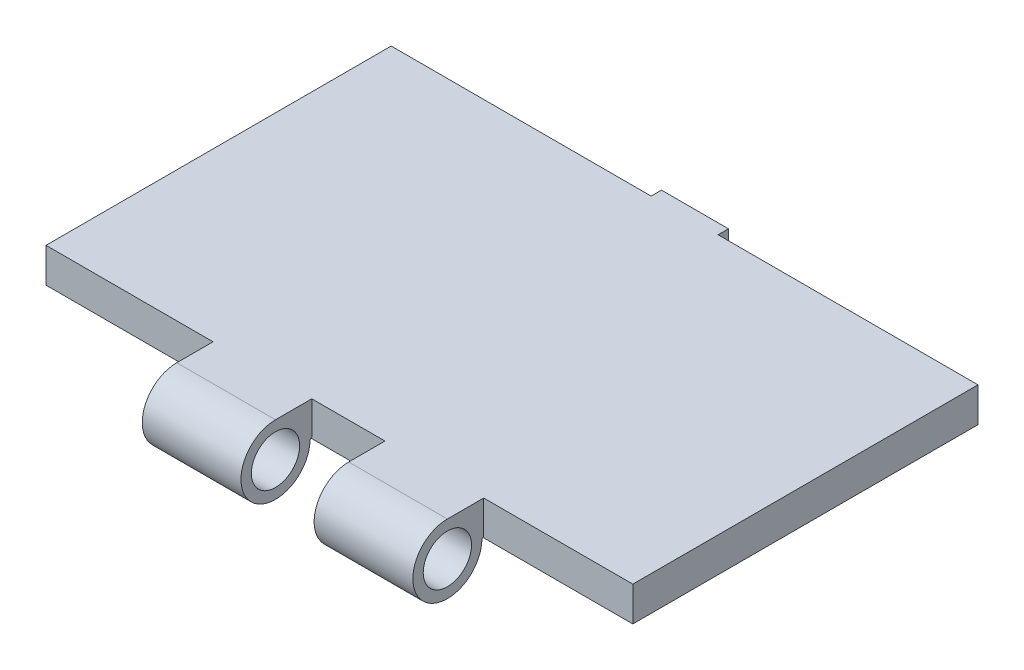
from build123d import *

# Parameters (mm, degrees)
ESQUISSE1_W                = 85
ESQUISSE1_H                = 50
BOSS_EXTRU_1_DEPTH         = 5
BOSS_EXTRU_2_START         = -14.3
BOSS_EXTRU_2_DEPTH         = 14.3
ESQUISSE3_R                = 3.5
ENL_V_MAT_EXTRU_1_DEPTH    = 14.3
R_P_TITION_LIN_AIRE2_COUNT = 2
R_P_TITION_LIN_AIRE2_PITCH = 24.9
BOSS_EXTRU_3_DEPTH         = 4.85
BOSS_EXTRU_3_DEPTH_BACK    = 4.85


# Read off the part's stored shape, not the designer's step: Boss.-Extru.2
with BuildPart() as part:
    # Esquisse1 → Boss.-Extru.1 (new body)
    with BuildSketch(Plane(origin=(0, 0, 0), x_dir=(1, 0, 0), z_dir=(0, 1, 0))):
        Rectangle(ESQUISSE1_W, ESQUISSE1_H)
    extrude(amount=BOSS_EXTRU_1_DEPTH)

    # Boss.-Extru.2 outline → Boss.-Extru.2 (add)
    with BuildSketch(Plane.ZY.offset(18.3).offset(BOSS_EXTRU_2_START)):
        with BuildLine():
            Line((25, 5), (25, 0.23226176))
            Line((25, 0.23226176), (25.260006787, -0.008238034))
            ThreePointArc((25.260006787, -0.008238034), (33.798445292, -3.53262012), (30.26, 5))
            Line((30.26, 5), (25, 5))
        make_face()
    boss_extru_2 = extrude(amount=BOSS_EXTRU_2_DEPTH)

    # Esquisse3 → Enlèv. mat.-Extru.1 (cut)
    with BuildSketch(Plane.ZY.offset(18.3)):
        with Locations((30.26, 0)):
            Circle(ESQUISSE3_R)
    enl_v_mat_extru_1 = extrude(amount=-ENL_V_MAT_EXTRU_1_DEPTH, mode=Mode.SUBTRACT)

    # Répétition linéaire2: Boss.-Extru.2, Enlèv. mat.-Extru.1 ×2
    with Locations(*[(i * R_P_TITION_LIN_AIRE2_PITCH, 0, 0) for i in range(1, R_P_TITION_LIN_AIRE2_COUNT)]):
        add(boss_extru_2)
        add(enl_v_mat_extru_1, mode=Mode.SUBTRACT)

    # Esquisse4 → Boss.-Extru.3 (add, two sides: drawn at the far end of the back side and taken through both)
    with BuildSketch(Plane(origin=(0, 0, 0), x_dir=(0, 0, -1), z_dir=(1, 0, 0)).offset(-BOSS_EXTRU_3_DEPTH_BACK)):
        with BuildLine():
            Line((26.5, 5), (25, 5))
            Line((25, 5), (25, -2.5))
            ThreePointArc((25, -2.5), (24.25, -3.25), (25, -4))
            Line((25, -4), (26.5, -4))
            Line((26.5, -4), (26.5, 5))
        make_face()
    extrude(amount=BOSS_EXTRU_3_DEPTH + BOSS_EXTRU_3_DEPTH_BACK)


solid = part.part
